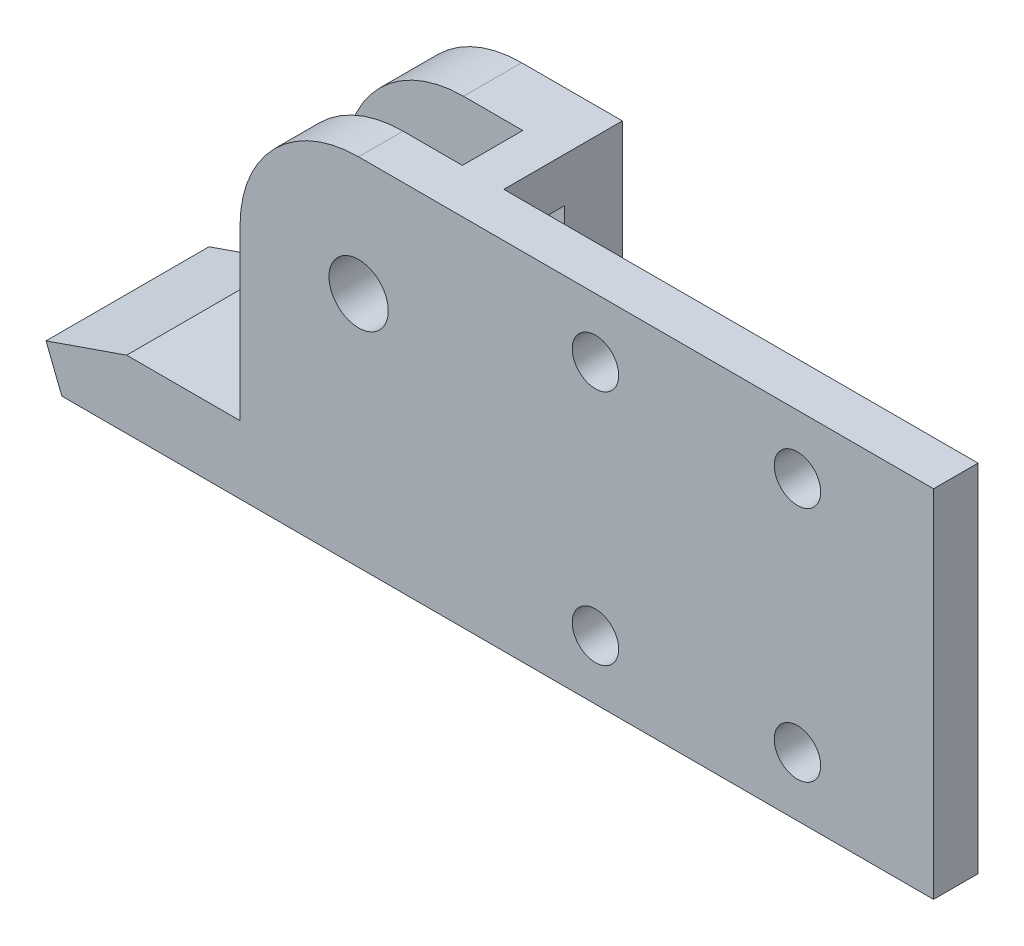
from build123d import *

# Parameters (mm, degrees)
SKETCH2_R                  = 3.175
BOSS_EXTRUDE1_DEPTH        = 4.7625
BOSS_EXTRUDE2_START        = 12.7
BOSS_EXTRUDE2_DEPTH        = 12.7
SKETCH12_W                 = 6.477
SKETCH12_H                 = 21.856650617
CUT_EXTRUDE1_DEPTH         = 24.13
SKETCH12_3_W               = 6.477
SKETCH12_3_H               = 4.7625
CUT_EXTRUDE2_DEPTH         = 19.05
TAP_DRILL_FOR_10_32_TAP1_D = 4.0386
F_10_CLEARANCE_HOLE2_D     = 4.9784


with BuildPart() as part:
    # Sketch2 → Boss-Extrude1 (new body)
    with BuildSketch(Plane.XY):
        with BuildLine():
            Line((-67.986186343, -228.533359856), (-69.686856366, -224.252380141))
            Line((-69.686856366, -224.252380141), (-61.0470258, -221.260552334))
            Line((-61.0470258, -221.260552334), (-48.895, -221.260552334))
            Line((-48.895, -221.260552334), (-48.895, -203.133359856))
            ThreePointArc((-48.895, -203.133359856), (-45.175256121, -194.153103735), (-36.195, -190.433359856))
            Line((-36.195, -190.433359856), (25.4, -190.433359856))
            Line((25.4, -190.433359856), (25.4, -228.533359856))
            Line((25.4, -228.533359856), (-67.986186343, -228.533359856))
        make_face()
        with Locations((-36.195, -203.133359856)):
            Circle(SKETCH2_R, mode=Mode.SUBTRACT)
    extrude(amount=BOSS_EXTRUDE1_DEPTH)

    # Sketch11 → Boss-Extrude2 (add)
    with BuildSketch(Plane(origin=(0, 0, 0), x_dir=(-1, 0, 0), z_dir=(0, 0, -1)).offset(BOSS_EXTRUDE2_START)):
        with BuildLine():
            Line((25.4, -190.433359856), (25.4, -228.533359856))
            Line((25.4, -228.533359856), (67.986186343, -228.533359856))
            Line((67.986186343, -228.533359856), (69.686856366, -224.252380141))
            Line((69.686856366, -224.252380141), (61.0470258, -221.260552334))
            Line((61.0470258, -221.260552334), (48.895, -221.260552334))
            Line((48.895, -221.260552334), (48.895, -203.133359856))
            ThreePointArc((48.895, -203.133359856), (45.175256121, -194.153103735), (36.195, -190.433359856))
            Line((36.195, -190.433359856), (25.4, -190.433359856))
        make_face()
    extrude(amount=-BOSS_EXTRUDE2_DEPTH)

    # Sketch12 → Cut-Extrude1 (cut)
    with BuildSketch(Plane.ZY.offset(48.895)):
        with Locations((-3.2385, -206.124185165)):
            Rectangle(SKETCH12_W, SKETCH12_H)
    extrude(amount=-CUT_EXTRUDE1_DEPTH, mode=Mode.SUBTRACT)

    # Sketch12<3> → Cut-Extrude2 (cut)
    with BuildSketch(Plane.ZY.offset(48.895)):
        with Locations((-3.2385, -192.814609856)):
            Rectangle(SKETCH12_3_W, SKETCH12_3_H)
    extrude(amount=-CUT_EXTRUDE2_DEPTH, mode=Mode.SUBTRACT)

    # Tap Drill for #10-32 Tap1 (through all)
    with Locations(Plane.XY.offset(-6.477)):
        with Locations((-36.195, -203.133359856)):
            Hole(TAP_DRILL_FOR_10_32_TAP1_D / 2)

    # #10 Clearance Hole2 (through all)
    with Locations(Plane.XY.offset(4.7625)):
        with Locations((-10.8204, -196.783359856), (-10.8204, -222.183359856), (10.8204, -222.183359856), (10.8204, -196.783359856)):
            Hole(F_10_CLEARANCE_HOLE2_D / 2)


solid = part.part
